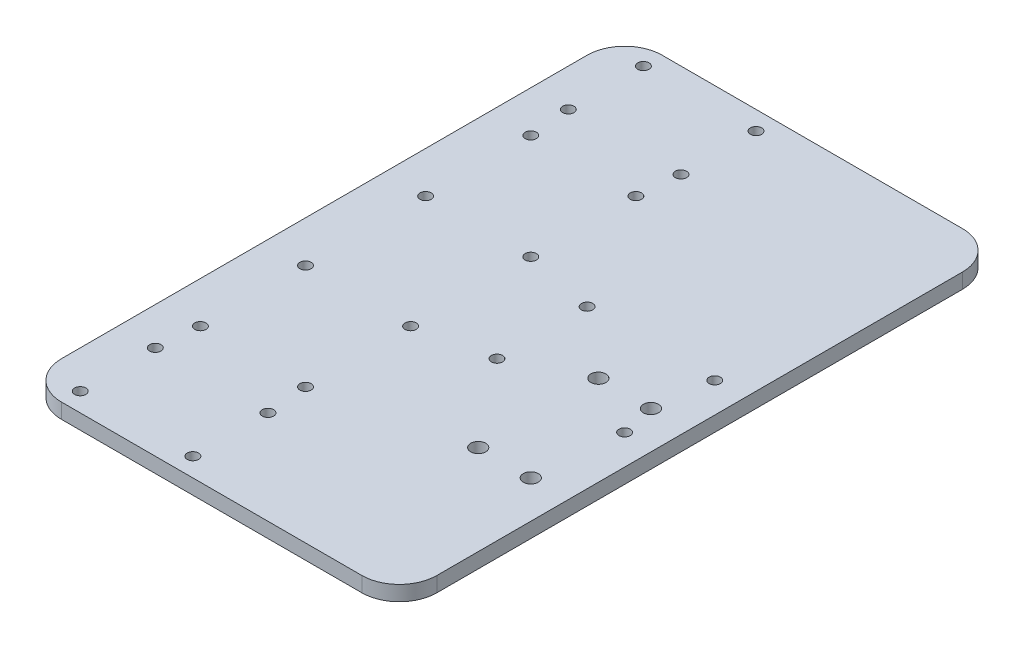
from build123d import *

# Parameters (mm, degrees)
SKETCH_1_W                  = 100
SKETCH_1_H                  = 160
EXTRUDE_1_DEPTH             = 4
SKETCH_2_R                  = 2
CUT_EXTRUDE_1_DEPTH         = 4
SKETCH_3_R                  = 1.5
CUT_EXTRUDE_2_DEPTH         = 4
FILLET_1_R                  = 10
SKETCH_4_R                  = 1.5
CUT_EXTRUDE_3_DEPTH         = 4
SKETCH_5_R                  = 1.5
CUT_EXTRUDE_4_DEPTH         = 10
PATTERN_LINEAR_1_COUNT      = 2
PATTERN_LINEAR_1_PITCH      = 30
PATTERN_LINEAR_1_COUNT_DIR2 = 2
PATTERN_LINEAR_1_PITCH_DIR2 = 20
MIRROR_2_COPY_1_SKETCH_R    = 1.5
MIRROR_2_COPY_1_DEPTH       = 10
MIRROR_2_COPY_2_SKETCH_R    = 1.5
MIRROR_2_COPY_2_DEPTH       = 10
MIRROR_2_COPY_3_SKETCH_R    = 1.5
MIRROR_2_COPY_3_DEPTH       = 10
MIRROR_2_COPY_4_SKETCH_R    = 1.5
MIRROR_2_COPY_4_DEPTH       = 10


with BuildPart() as part:
    # 草图1 → 凸台-拉伸1 (new body)
    with BuildSketch(Plane(origin=(0, 0, 0), x_dir=(1, 0, 0), z_dir=(0, 1, 0))):
        Rectangle(SKETCH_1_W, SKETCH_1_H)
    extrude(amount=EXTRUDE_1_DEPTH)

    # 草图2 → 切除-拉伸1 (cut)
    with BuildSketch(Plane(origin=(0, 4, 0), x_dir=(1, 0, 0), z_dir=(0, 1, 0))):
        with Locations((40, -3)):
            Circle(SKETCH_2_R)
        with Locations((26, -3)):
            Circle(SKETCH_2_R)
        with Locations((40, -35)):
            Circle(SKETCH_2_R)
        with Locations((26, -35)):
            Circle(SKETCH_2_R)
    extrude(amount=-CUT_EXTRUDE_1_DEPTH, mode=Mode.SUBTRACT)

    # 草图3 → 切除-拉伸2 (cut)
    with BuildSketch(Plane(origin=(0, 4, 0), x_dir=(1, 0, 0), z_dir=(0, 1, 0))):
        with Locations((-39, 44)):
            Circle(SKETCH_3_R)
        with Locations((-11, 44)):
            Circle(SKETCH_3_R)
        with Locations((-11, 16)):
            Circle(SKETCH_3_R)
        with Locations((-39, 16)):
            Circle(SKETCH_3_R)
    cut_extrude_2 = extrude(amount=-CUT_EXTRUDE_2_DEPTH, mode=Mode.SUBTRACT)

    # 圆角1
    fillet_1_edges = [part.edges().sort_by_distance(p)[0] for p in [
        (50, 2, -80),
        (50, 2, 80),
        (-50, 2, 80),
        (-50, 2, -80),
    ]]
    fillet(fillet_1_edges, radius=FILLET_1_R)

    # 镜向1: 切除-拉伸2 across plane
    add(cut_extrude_2.mirror(Plane.XY), mode=Mode.SUBTRACT)

    # 草图4 → 切除-拉伸3 (cut)
    with BuildSketch(Plane(origin=(0, 4, 0), x_dir=(1, 0, 0), z_dir=(0, 1, 0))):
        with Locations((42, 12)):
            Circle(SKETCH_4_R)
        with Locations((8, 12)):
            Circle(SKETCH_4_R)
        with Locations((42, -12)):
            Circle(SKETCH_4_R)
        with Locations((8, -12)):
            Circle(SKETCH_4_R)
    extrude(amount=-CUT_EXTRUDE_3_DEPTH, mode=Mode.SUBTRACT)

    # 草图5 → 切除-拉伸4 (cut)
    with BuildSketch(Plane(origin=(0, 4, 0), x_dir=(1, 0, 0), z_dir=(0, 1, 0))):
        with Locations((-40, 75)):
            Circle(SKETCH_5_R)
    cut_extrude_4 = extrude(amount=-CUT_EXTRUDE_4_DEPTH, mode=Mode.SUBTRACT)

    # 阵列(线性)1: Cut-Extrude 4 2 × 2
    with Locations(*[(i * PATTERN_LINEAR_1_PITCH, 0, j * PATTERN_LINEAR_1_PITCH_DIR2) for i in range(PATTERN_LINEAR_1_COUNT) for j in range(PATTERN_LINEAR_1_COUNT_DIR2) if (i, j) != (0, 0)]):
        add(cut_extrude_4, mode=Mode.SUBTRACT)

    # 镜向2 copy 1 sketch → 镜向2 copy 1 (cut)
    with BuildSketch(Plane(origin=(0, 4, -20), x_dir=(1, 0, 0), z_dir=(0, 1, 0))):
        with Locations((-40, -75)):
            Circle(MIRROR_2_COPY_1_SKETCH_R)
    extrude(amount=-MIRROR_2_COPY_1_DEPTH, mode=Mode.SUBTRACT)

    # 镜向2 copy 2 sketch → 镜向2 copy 2 (cut)
    with BuildSketch(Plane(origin=(30, 4, 0), x_dir=(1, 0, 0), z_dir=(0, 1, 0))):
        with Locations((-40, -75)):
            Circle(MIRROR_2_COPY_2_SKETCH_R)
    extrude(amount=-MIRROR_2_COPY_2_DEPTH, mode=Mode.SUBTRACT)

    # 镜向2 copy 3 sketch → 镜向2 copy 3 (cut)
    with BuildSketch(Plane(origin=(30, 4, -20), x_dir=(1, 0, 0), z_dir=(0, 1, 0))):
        with Locations((-40, -75)):
            Circle(MIRROR_2_COPY_3_SKETCH_R)
    extrude(amount=-MIRROR_2_COPY_3_DEPTH, mode=Mode.SUBTRACT)

    # 镜向2 copy 4 sketch → 镜向2 copy 4 (cut)
    with BuildSketch(Plane(origin=(0, 4, 0), x_dir=(1, 0, 0), z_dir=(0, 1, 0))):
        with Locations((-40, -75)):
            Circle(MIRROR_2_COPY_4_SKETCH_R)
    extrude(amount=-MIRROR_2_COPY_4_DEPTH, mode=Mode.SUBTRACT)


solid = part.part
